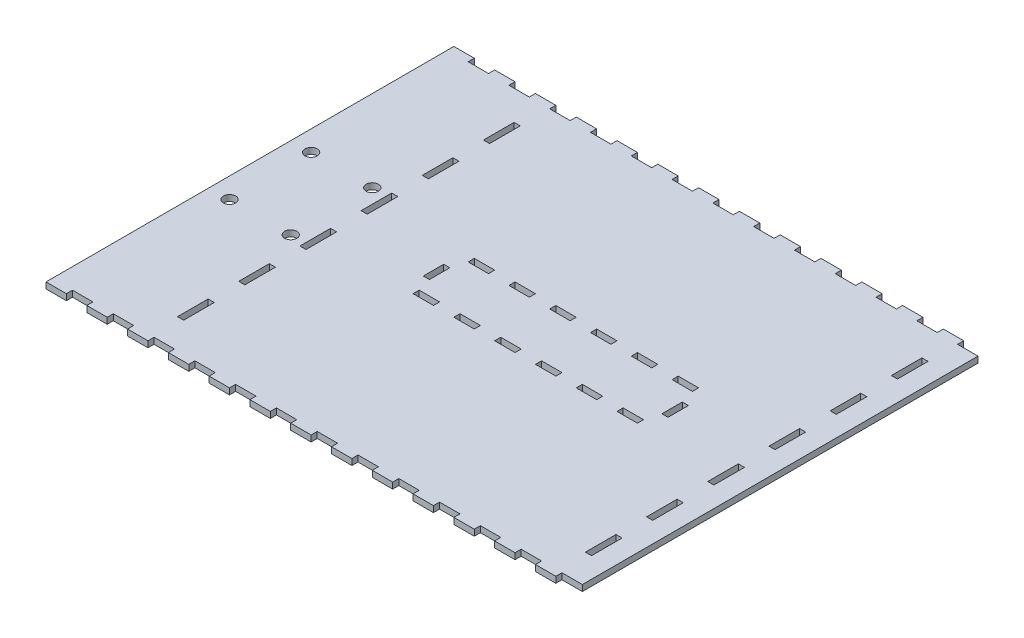
from build123d import *

# Parameters (mm, degrees)
SKETCH3_W           = 3
SKETCH3_H           = 15
SKETCH3_R           = 3
SKETCH3_H_2         = 10
SKETCH3_W_2         = 10
SKETCH3_H_3         = 3
BOSS_EXTRUDE1_DEPTH = 3


with BuildPart() as part:
    # Sketch3 → Boss-Extrude1 (new body)
    with BuildSketch(Plane(origin=(0, 0, 0), x_dir=(1, 0, 0), z_dir=(0, 1, 0))):
        Polygon((-300, 97), (-300, -97), (-300, -100), (-290, -100), (-290, -97), (-280, -97), (-280, -100), (-270, -100), (-270, -97), (-260, -97), (-260, -100), (-250, -100), (-250, -97), (-240, -97), (-240, -100), (-230, -100), (-230, -97), (-220, -97), (-220, -100), (-210, -100), (-210, -97), (-200, -97), (-200, -100), (-190, -100), (-190, -97), (-180, -97), (-180, -100), (-170, -100), (-170, -97), (-160, -97), (-160, -100), (-150, -100), (-150, -97), (-140, -97), (-140, -100), (-130, -100), (-130, -97), (-120, -97), (-120, -100), (-110, -100), (-110, -97), (-100, -97), (-100, -100), (-90, -100), (-90, -97), (-80, -97), (-80, -100), (-70, -100), (-70, -97), (-60, -97), (-60, -100), (-50, -100), (-50, -97), (-40, -97), (-40, 97), (-50, 97), (-50, 100), (-60, 100), (-60, 97), (-70, 97), (-70, 100), (-80, 100), (-80, 97), (-90, 97), (-90, 100), (-100, 100), (-100, 97), (-110, 97), (-110, 100), (-120, 100), (-120, 97), (-130, 97), (-130, 100), (-140, 100), (-140, 97), (-150, 97), (-150, 100), (-160, 100), (-160, 97), (-170, 97), (-170, 100), (-180, 100), (-180, 97), (-190, 97), (-190, 100), (-200, 100), (-200, 97), (-210, 97), (-210, 100), (-220, 100), (-220, 97), (-230, 97), (-230, 100), (-240, 100), (-240, 97), (-250, 97), (-250, 100), (-260, 100), (-260, 97), (-270, 97), (-270, 100), (-280, 100), (-280, 97), (-290, 97), (-290, 100), (-300, 100), align=None)
        with Locations((-251.5, -75)):
            Rectangle(SKETCH3_W, SKETCH3_H, mode=Mode.SUBTRACT)
        with Locations((-251.5, -45)):
            Rectangle(SKETCH3_W, SKETCH3_H, mode=Mode.SUBTRACT)
        with Locations((-290, -20)):
            Circle(SKETCH3_R, mode=Mode.SUBTRACT)
        with Locations((-260, -20)):
            Circle(SKETCH3_R, mode=Mode.SUBTRACT)
        with Locations((-251.5, -15)):
            Rectangle(SKETCH3_W, SKETCH3_H, mode=Mode.SUBTRACT)
        with Locations((-208.5, 0)):
            Rectangle(SKETCH3_W, SKETCH3_H_2, mode=Mode.SUBTRACT)
        with Locations((-200, -13.5)):
            Rectangle(SKETCH3_W_2, SKETCH3_H_3, mode=Mode.SUBTRACT)
        with Locations((-180, -13.5)):
            Rectangle(SKETCH3_W_2, SKETCH3_H_3, mode=Mode.SUBTRACT)
        with Locations((-51.5, -75)):
            Rectangle(SKETCH3_W, SKETCH3_H, mode=Mode.SUBTRACT)
        with Locations((-160, -13.5)):
            Rectangle(SKETCH3_W_2, SKETCH3_H_3, mode=Mode.SUBTRACT)
        with Locations((-140, -13.5)):
            Rectangle(SKETCH3_W_2, SKETCH3_H_3, mode=Mode.SUBTRACT)
        with Locations((-120, -13.5)):
            Rectangle(SKETCH3_W_2, SKETCH3_H_3, mode=Mode.SUBTRACT)
        with Locations((-51.5, -45)):
            Rectangle(SKETCH3_W, SKETCH3_H, mode=Mode.SUBTRACT)
        with Locations((-100, -13.5)):
            Rectangle(SKETCH3_W_2, SKETCH3_H_3, mode=Mode.SUBTRACT)
        with Locations((-91.5, 0)):
            Rectangle(SKETCH3_W, SKETCH3_H_2, mode=Mode.SUBTRACT)
        with Locations((-51.5, -15)):
            Rectangle(SKETCH3_W, SKETCH3_H, mode=Mode.SUBTRACT)
        with Locations((-290, 20)):
            Circle(SKETCH3_R, mode=Mode.SUBTRACT)
        with Locations((-251.5, 15)):
            Rectangle(SKETCH3_W, SKETCH3_H, mode=Mode.SUBTRACT)
        with Locations((-260, 20)):
            Circle(SKETCH3_R, mode=Mode.SUBTRACT)
        with Locations((-251.5, 45)):
            Rectangle(SKETCH3_W, SKETCH3_H, mode=Mode.SUBTRACT)
        with Locations((-200, 13.5)):
            Rectangle(SKETCH3_W_2, SKETCH3_H_3, mode=Mode.SUBTRACT)
        with Locations((-180, 13.5)):
            Rectangle(SKETCH3_W_2, SKETCH3_H_3, mode=Mode.SUBTRACT)
        with Locations((-251.5, 75)):
            Rectangle(SKETCH3_W, SKETCH3_H, mode=Mode.SUBTRACT)
        with Locations((-160, 13.5)):
            Rectangle(SKETCH3_W_2, SKETCH3_H_3, mode=Mode.SUBTRACT)
        with Locations((-140, 13.5)):
            Rectangle(SKETCH3_W_2, SKETCH3_H_3, mode=Mode.SUBTRACT)
        with Locations((-120, 13.5)):
            Rectangle(SKETCH3_W_2, SKETCH3_H_3, mode=Mode.SUBTRACT)
        with Locations((-100, 13.5)):
            Rectangle(SKETCH3_W_2, SKETCH3_H_3, mode=Mode.SUBTRACT)
        with Locations((-51.5, 15)):
            Rectangle(SKETCH3_W, SKETCH3_H, mode=Mode.SUBTRACT)
        with Locations((-51.5, 45)):
            Rectangle(SKETCH3_W, SKETCH3_H, mode=Mode.SUBTRACT)
        with Locations((-51.5, 75)):
            Rectangle(SKETCH3_W, SKETCH3_H, mode=Mode.SUBTRACT)
    extrude(amount=BOSS_EXTRUDE1_DEPTH)


solid = part.part
